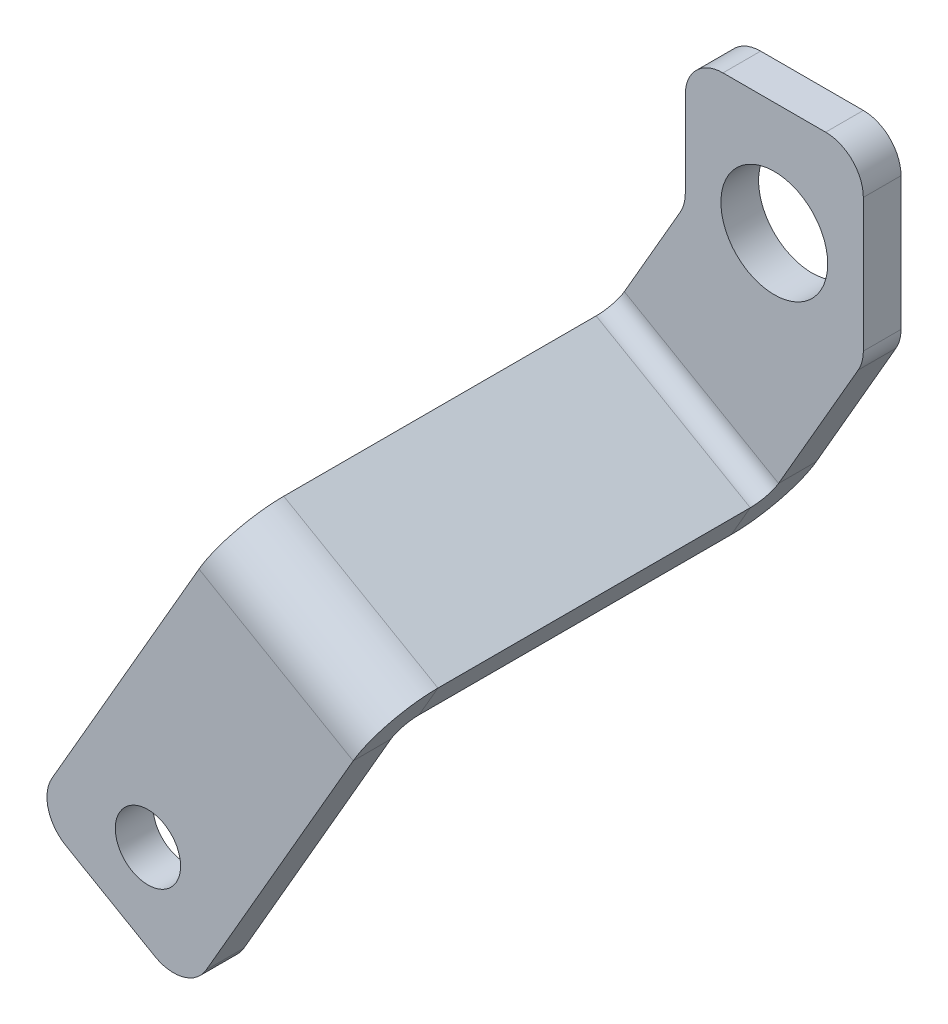
from build123d import *

# Parameters (mm, degrees)
BASE_FLANGE1_DEPTH   = 3.175
EDGE_FLANGE1_DEPTH   = 15
EDGE_FLANGE2_DEPTH   = 15
BOSS_EXTRUDE1_DEPTH  = 3.175
M5_CLEARANCE_HOLE1_D = 5.5
FILLET1_R            = 3.175
M8_CLEARANCE_HOLE1_D = 9


# Sheet-metal steps are written as plain solids
with BuildPart() as part:
    # Sketch2 → Base-Flange1 (new body)
    with BuildSketch(Plane.XY):
        Polygon((-136.862074611, 27.127820722), (-140.037074611, 21.628559408), (-153.027455668, 29.128559408), (-149.852455668, 34.627820722), (-139.057455668, 53.32530919), (-126.067074611, 45.82530919), align=None)
    extrude(amount=BASE_FLANGE1_DEPTH)

    # Edge-Flange1 section (across the edge) → Edge-Flange1 (add)
    with BuildSketch(Plane(origin=(-138.263705668, 54.700124518, 0), x_dir=(-0.49999999999999706, -0.8660254037844405, -3.491481338843133e-15), z_dir=(0.8660254037844405, -0.49999999999999706, 0))):
        with BuildLine():
            Line((-3.175, 1.5875), (-3.175, 27.899995))
            Line((-3.175, 27.899995), (0, 27.899995))
            Line((0, 27.899995), (0, 1.5875))
            ThreePointArc((0, 1.5875), (0.464967985, 0.464967985), (1.5875, 0))
            Line((1.5875, 0), (1.5875, -3.175))
            ThreePointArc((1.5875, -3.175), (-1.780096045, -1.780096045), (-3.175, 1.5875))
        make_face()
    extrude(amount=EDGE_FLANGE1_DEPTH)

    # Edge-Flange2 section (across the edge) → Edge-Flange2 (add)
    with BuildSketch(Plane(origin=(-123.685824611, 49.949755175, -29.487495), x_dir=(0, 0, 1), z_dir=(-0.8660254037844397, 0.4999999999999983, 0))):
        with BuildLine():
            Line((-3.175, 1.5875), (-3.175, 6.35))
            Line((-3.175, 6.35), (0, 6.35))
            Line((0, 6.35), (0, 1.5875))
            ThreePointArc((0, 1.5875), (0.464967985, 0.464967985), (1.5875, 0))
            Line((1.5875, 0), (1.5875, -3.175))
            ThreePointArc((1.5875, -3.175), (-1.780096045, -1.780096045), (-3.175, 1.5875))
        make_face()
    extrude(amount=EDGE_FLANGE2_DEPTH)

    # Sketch15 → Boss-Extrude1 (add)
    with BuildSketch(Plane(origin=(0, 0, -32.662495), x_dir=(-1, 0, 0), z_dir=(0, 0, -1))):
        Polygon((133.501205668, 62.949016489), (120.510824611, 55.449016489), (115.748324611, 63.69790846), (115.748324611, 78.93790846), (130.748324611, 78.93790846), (130.748324611, 67.717146347), align=None)
    extrude(amount=-BOSS_EXTRUDE1_DEPTH)

    # M5 Clearance Hole1 (through all)
    with Locations(Plane.XY.offset(3.175)):
        with Locations((-143.35726514, 30.877820722)):
            Hole(M5_CLEARANCE_HOLE1_D / 2)

    # Fillet1
    fillet1_edges = [part.edges().sort_by_distance(p)[0] for p in [
        (-140.037074611, 21.628559408, 1.5875),
        (-153.027455668, 29.128559408, 1.5875),
        (-130.748324611, 67.717146347, -31.074995),
        (-115.748324611, 63.69790846, -31.074995),
        (-115.748324611, 78.93790846, -31.074995),
        (-130.748324611, 78.93790846, -31.074995),
    ]]
    fillet(fillet1_edges, radius=FILLET1_R)

    # M8 Clearance Hole1 (through all)
    with Locations(Plane.XY.offset(-29.487495)):
        with Locations((-123.248324611, 69.41100346)):
            Hole(M8_CLEARANCE_HOLE1_D / 2)


solid = part.part
